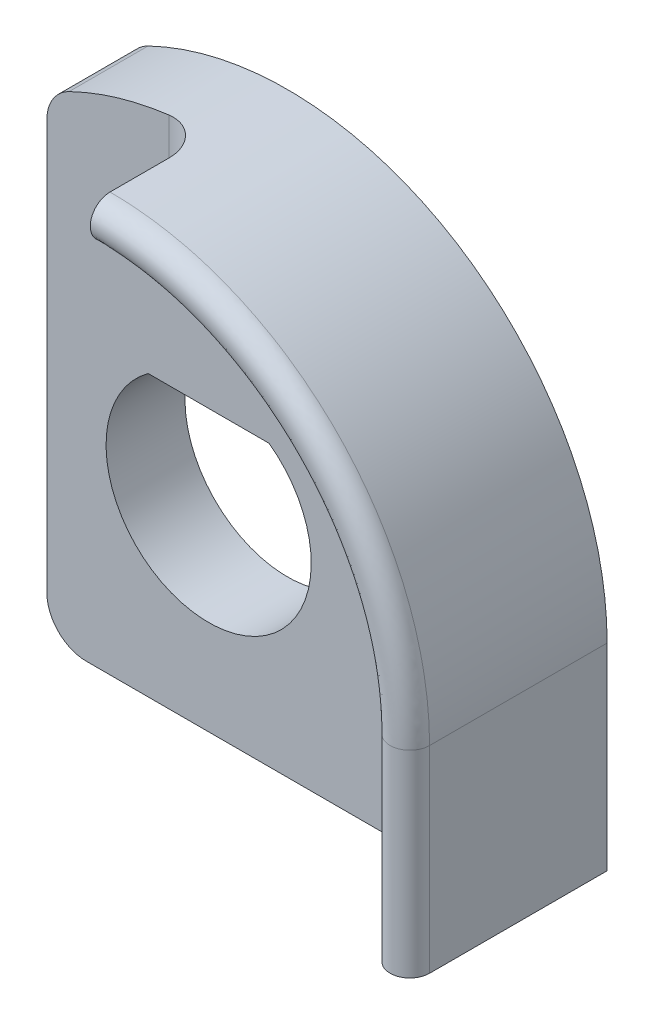
from build123d import *

# Parameters (mm, degrees)
SALIENTE_EXTRUIR1_DEPTH = 2
CORTAR_EXTRUIR1_REACH   = 13.628
CORTAR_EXTRUIR2_REACH   = 13.628
SALIENTE_EXTRUIR3_DEPTH = 3
REDONDEO3_R             = 0.5
REDONDEO4_R             = 1


with BuildPart() as part:
    # Croquis1 → Saliente-Extruir1 (new body)
    with BuildSketch(Plane.XY):
        with BuildLine():
            Line((8.1, 0), (8.1, -5))
            Line((8.1, -5), (-8.1, -5))
            Line((-8.1, -5), (-8.1, 0))
            ThreePointArc((-8.1, 0), (0, 8.1), (8.1, 0))
        make_face()
    extrude(amount=SALIENTE_EXTRUIR1_DEPTH)

    # Croquis4 → Cortar-Extruir1 (cut, up to next)
    with BuildSketch(Plane.XY.offset(2), mode=Mode.PRIVATE) as cortar_extruir1_sk1:
        with BuildLine():
            Line((-1.532970972, 2.1), (1.532970972, 2.1))
            ThreePointArc((1.532970972, 2.1), (0, -2.6), (-1.532970972, 2.1))
        make_face()
    cortar_extruir1_tool1 = extrude(cortar_extruir1_sk1.sketch, amount=-CORTAR_EXTRUIR1_REACH, mode=Mode.PRIVATE) & part.part
    add(cortar_extruir1_tool1.solids().sort_by_distance((0, -0.118931, 2))[0], mode=Mode.SUBTRACT)

    # Croquis5 → Cortar-Extruir2 (cut, up to next)
    with BuildSketch(Plane.XY.offset(2), mode=Mode.PRIVATE) as cortar_extruir2_sk1:
        with BuildLine():
            Line((-4.1, -5), (-4.1, 6.985699679))
            ThreePointArc((-4.1, 6.985699679), (-7.029224708, 4.024922359), (-8.1, 0))
            Line((-8.1, 0), (-8.1, -5))
            Line((-8.1, -5), (-4.1, -5))
        make_face()
    cortar_extruir2_tool1 = extrude(cortar_extruir2_sk1.sketch, amount=-CORTAR_EXTRUIR2_REACH, mode=Mode.PRIVATE) & part.part
    add(cortar_extruir2_tool1.solids().sort_by_distance((-5.920703, 0.103857, 2))[0], mode=Mode.SUBTRACT)

    # Croquis7 → Saliente-Extruir3 (add)
    with BuildSketch(Plane.XY.offset(2)):
        with BuildLine():
            Line((8.1, 0), (8.1, -5))
            Line((8.1, -5), (7.1, -5))
            Line((7.1, -5), (7.1, 0))
            ThreePointArc((7.1, 0), (5.020457997, 5.020458296), (-4.23e-07, 7.1))
            Line((-4.23e-07, 7.1), (-4.23e-07, 8.1))
            ThreePointArc((-4.23e-07, 8.1), (5.727564778, 5.727565077), (8.1, 0))
        make_face()
    extrude(amount=SALIENTE_EXTRUIR3_DEPTH)

    # Redondeo3
    redondeo3_edges = [part.edges().sort_by_distance(p)[0] for p in [
        (5.727564778, 5.727565077, 5),
        (5.020457997, 5.020458296, 5),
        (7.1, -2.5, 5),
        (8.1, -2.5, 5),
    ]]
    fillet(redondeo3_edges, radius=REDONDEO3_R - 0.0001)  # a hair under: the kernel refuses the full size

    # Redondeo4
    redondeo4_edges = [part.edges().sort_by_distance(p)[0] for p in [
        (-4.1, -5, 1),
        (-4.1, 6.985699679, 1),
        (-4.23e-07, 7.6, 2),
    ]]
    fillet(redondeo4_edges, radius=REDONDEO4_R)


solid = part.part
